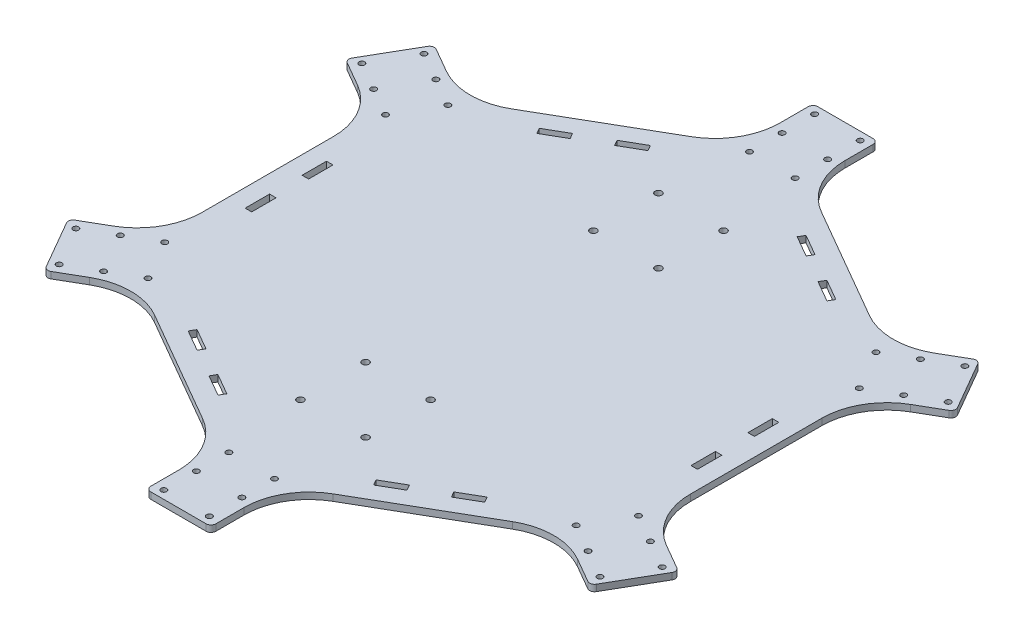
from build123d import *

# Parameters (mm, degrees)
SKETCH1_R             = 1.75
SKETCH1_W             = 4
SKETCH1_H             = 15
BOSS_EXTRUDE1_DEPTH   = 2
FILLET1_R             = 3
CIRPATTERN3_START     = -2
CIRPATTERN3_DEPTH     = 4
M5X0_8_TAPPED_HOLE1_D = 4.2


# Read off the part's stored shape, not the designer's step: CirPattern3
with BuildPart() as part:
    # Sketch1 → Boss-Extrude1 (new, symmetric)
    with BuildSketch(Plane(origin=(0, 0, 0), x_dir=(1, 0, 0), z_dir=(0, 1, 0))):
        with BuildLine():
            Line((109.999999797, 109.696551029), (40, 150.111069754))
            ThreePointArc((40, 150.111069754), (25.358983849, 164.752085906), (20, 184.752085906))
            Line((20, 184.752085906), (20, 205))
            Line((20, 205), (-20, 205))
            Line((-20, 205), (-20, 184.752085906))
            ThreePointArc((-20, 184.752085906), (-25.358983849, 164.752085906), (-40, 150.111069754))
            Line((-40, 150.111069754), (-109.999999797, 109.696551029))
            ThreePointArc((-109.999999797, 109.696551029), (-129.999999797, 104.33756718), (-149.999999797, 109.696551029))
            Line((-149.999999797, 109.696551029), (-167.535207776, 119.820508076))
            Line((-167.535207776, 119.820508076), (-187.535207776, 85.179491924))
            Line((-187.535207776, 85.179491924), (-169.999999797, 75.055534877))
            ThreePointArc((-169.999999797, 75.055534877), (-155.358983645, 60.414518726), (-149.999999797, 40.414518726))
            Line((-149.999999797, 40.414518726), (-149.999999797, -40.414518726))
            ThreePointArc((-149.999999797, -40.414518726), (-155.358983645, -60.414518726), (-169.999999797, -75.055534877))
            Line((-169.999999797, -75.055534877), (-187.535207776, -85.179491924))
            Line((-187.535207776, -85.179491924), (-167.535207776, -119.820508076))
            Line((-167.535207776, -119.820508076), (-149.999999797, -109.696551029))
            ThreePointArc((-149.999999797, -109.696551029), (-129.999999797, -104.33756718), (-109.999999797, -109.696551029))
            Line((-109.999999797, -109.696551029), (-40, -150.111069754))
            ThreePointArc((-40, -150.111069754), (-25.358983849, -164.752085906), (-20, -184.752085906))
            Line((-20, -184.752085906), (-20, -205))
            Line((-20, -205), (20, -205))
            Line((20, -205), (20, -184.752085906))
            ThreePointArc((20, -184.752085906), (25.358983849, -164.752085906), (40, -150.111069754))
            Line((40, -150.111069754), (109.999999797, -109.696551029))
            ThreePointArc((109.999999797, -109.696551029), (129.999999797, -104.33756718), (149.999999797, -109.696551029))
            Line((149.999999797, -109.696551029), (167.535207776, -119.820508076))
            Line((167.535207776, -119.820508076), (187.535207776, -85.179491924))
            Line((187.535207776, -85.179491924), (169.999999797, -75.055534877))
            ThreePointArc((169.999999797, -75.055534877), (155.358983645, -60.414518726), (149.999999797, -40.414518726))
            Line((149.999999797, -40.414518726), (149.999999797, 40.414518726))
            ThreePointArc((149.999999797, 40.414518726), (155.358983645, 60.414518726), (169.999999797, 75.055534877))
            Line((169.999999797, 75.055534877), (187.535207776, 85.179491924))
            Line((187.535207776, 85.179491924), (167.535207776, 119.820508076))
            Line((167.535207776, 119.820508076), (149.999999797, 109.696551029))
            ThreePointArc((149.999999797, 109.696551029), (129.999999797, 104.33756718), (109.999999797, 109.696551029))
        make_face()
        with Locations(Location((-14, 200, 0), (0, 0, 270))):
            Circle(SKETCH1_R, mode=Mode.SUBTRACT)
        with Locations(Location((-14, 180, 0), (0, 0, 270))):
            Circle(SKETCH1_R, mode=Mode.SUBTRACT)
        with Locations(Location((-14, 160, 0), (0, 0, 270))):
            Circle(SKETCH1_R, mode=Mode.SUBTRACT)
        with Locations(Location((14, 200, 0), (0, 0, 270))):
            Circle(SKETCH1_R, mode=Mode.SUBTRACT)
        with Locations(Location((14, 180, 0), (0, 0, 270))):
            Circle(SKETCH1_R, mode=Mode.SUBTRACT)
        with Locations(Location((14, 160, 0), (0, 0, 270))):
            Circle(SKETCH1_R, mode=Mode.SUBTRACT)
        with Locations(Location((145.564064606, 67.875644347, 0), (0, 0, 270))):
            Circle(SKETCH1_R, mode=Mode.SUBTRACT)
        with Locations(Location((131.564064606, 92.124355653, 0), (0, 0, 270))):
            Circle(SKETCH1_R, mode=Mode.SUBTRACT)
        with Locations(Location((162.884572681, 77.875644347, 0), (0, 0, 270))):
            Circle(SKETCH1_R, mode=Mode.SUBTRACT)
        with Locations(Location((180.205080757, 87.875644347, 0), (0, 0, 270))):
            Circle(SKETCH1_R, mode=Mode.SUBTRACT)
        with Locations(Location((166.205080757, 112.124355653, 0), (0, 0, 270))):
            Circle(SKETCH1_R, mode=Mode.SUBTRACT)
        with Locations(Location((148.884572681, 102.124355653, 0), (0, 0, 270))):
            Circle(SKETCH1_R, mode=Mode.SUBTRACT)
        with Locations(Location((131.564064606, -92.124355653, 0), (0, 0, 270))):
            Circle(SKETCH1_R, mode=Mode.SUBTRACT)
        with Locations(Location((145.564064606, -67.875644347, 0), (0, 0, 270))):
            Circle(SKETCH1_R, mode=Mode.SUBTRACT)
        with Locations(Location((148.884572681, -102.124355653, 0), (0, 0, 270))):
            Circle(SKETCH1_R, mode=Mode.SUBTRACT)
        with Locations(Location((166.205080757, -112.124355653, 0), (0, 0, 270))):
            Circle(SKETCH1_R, mode=Mode.SUBTRACT)
        with Locations(Location((180.205080757, -87.875644347, 0), (0, 0, 270))):
            Circle(SKETCH1_R, mode=Mode.SUBTRACT)
        with Locations(Location((162.884572681, -77.875644347, 0), (0, 0, 270))):
            Circle(SKETCH1_R, mode=Mode.SUBTRACT)
        with Locations(Location((-14, -160, 0), (0, 0, 270))):
            Circle(SKETCH1_R, mode=Mode.SUBTRACT)
        with Locations(Location((14, -160, 0), (0, 0, 270))):
            Circle(SKETCH1_R, mode=Mode.SUBTRACT)
        with Locations(Location((-14, -180, 0), (0, 0, 270))):
            Circle(SKETCH1_R, mode=Mode.SUBTRACT)
        with Locations(Location((-14, -200, 0), (0, 0, 270))):
            Circle(SKETCH1_R, mode=Mode.SUBTRACT)
        with Locations(Location((14, -200, 0), (0, 0, 270))):
            Circle(SKETCH1_R, mode=Mode.SUBTRACT)
        with Locations(Location((14, -180, 0), (0, 0, 270))):
            Circle(SKETCH1_R, mode=Mode.SUBTRACT)
        with Locations(Location((-145.564064606, -67.875644347, 0), (0, 0, 270))):
            Circle(SKETCH1_R, mode=Mode.SUBTRACT)
        with Locations(Location((-131.564064606, -92.124355653, 0), (0, 0, 270))):
            Circle(SKETCH1_R, mode=Mode.SUBTRACT)
        with Locations(Location((-162.884572681, -77.875644347, 0), (0, 0, 270))):
            Circle(SKETCH1_R, mode=Mode.SUBTRACT)
        with Locations(Location((-180.205080757, -87.875644347, 0), (0, 0, 270))):
            Circle(SKETCH1_R, mode=Mode.SUBTRACT)
        with Locations(Location((-166.205080757, -112.124355653, 0), (0, 0, 270))):
            Circle(SKETCH1_R, mode=Mode.SUBTRACT)
        with Locations(Location((-148.884572681, -102.124355653, 0), (0, 0, 270))):
            Circle(SKETCH1_R, mode=Mode.SUBTRACT)
        with Locations(Location((-131.564064606, 92.124355653, 0), (0, 0, 270))):
            Circle(SKETCH1_R, mode=Mode.SUBTRACT)
        with Locations(Location((-145.564064606, 67.875644347, 0), (0, 0, 270))):
            Circle(SKETCH1_R, mode=Mode.SUBTRACT)
        with Locations(Location((-148.884572681, 102.124355653, 0), (0, 0, 270))):
            Circle(SKETCH1_R, mode=Mode.SUBTRACT)
        with Locations(Location((-166.205080757, 112.124355653, 0), (0, 0, 270))):
            Circle(SKETCH1_R, mode=Mode.SUBTRACT)
        with Locations(Location((-180.205080757, 87.875644347, 0), (0, 0, 270))):
            Circle(SKETCH1_R, mode=Mode.SUBTRACT)
        with Locations(Location((-162.884572681, 77.875644347, 0), (0, 0, 270))):
            Circle(SKETCH1_R, mode=Mode.SUBTRACT)
        Polygon((89.150635095, -104.413429511), (76.160254038, -111.913429511), (78.160254038, -115.377531126), (91.150635095, -107.877531126), align=None, mode=Mode.SUBTRACT)
        with Locations((137, 17.5)):
            Rectangle(SKETCH1_W, SKETCH1_H, mode=Mode.SUBTRACT)
        with Locations((137, -17.5)):
            Rectangle(SKETCH1_W, SKETCH1_H, mode=Mode.SUBTRACT)
        Polygon((58.839745962, -121.913429511), (45.849364905, -129.413429511), (47.849364905, -132.877531126), (60.839745962, -125.377531126), align=None, mode=Mode.SUBTRACT)
        Polygon((-45.849364905, -129.413429511), (-58.839745962, -121.913429511), (-60.839745962, -125.377531126), (-47.849364905, -132.877531126), align=None, mode=Mode.SUBTRACT)
        Polygon((-76.160254038, -111.913429511), (-89.150635095, -104.413429511), (-91.150635095, -107.877531126), (-78.160254038, -115.377531126), align=None, mode=Mode.SUBTRACT)
        with Locations((-137, -17.5)):
            Rectangle(SKETCH1_W, SKETCH1_H, mode=Mode.SUBTRACT)
        with Locations((-137, 17.5)):
            Rectangle(SKETCH1_W, SKETCH1_H, mode=Mode.SUBTRACT)
        Polygon((-89.150635095, 104.413429511), (-76.160254038, 111.913429511), (-78.160254038, 115.377531126), (-91.150635095, 107.877531126), align=None, mode=Mode.SUBTRACT)
        Polygon((-58.839745962, 121.913429511), (-45.849364905, 129.413429511), (-47.849364905, 132.877531126), (-60.839745962, 125.377531126), align=None, mode=Mode.SUBTRACT)
        Polygon((45.849364905, 129.413429511), (58.839745962, 121.913429511), (60.839745962, 125.377531126), (47.849364905, 132.877531126), align=None, mode=Mode.SUBTRACT)
        Polygon((76.160254038, 111.913429511), (89.150635095, 104.413429511), (91.150635095, 107.877531126), (78.160254038, 115.377531126), align=None, mode=Mode.SUBTRACT)
    extrude(amount=BOSS_EXTRUDE1_DEPTH, both=True)

    # Fillet1
    fillet1_edges = [part.edges().sort_by_distance(p)[0] for p in [
        (-20, 0, -205),
        (20, 0, -205),
    ]]
    fillet(fillet1_edges, radius=FILLET1_R)

    # CirPattern3 outline → CirPattern3 (cut)
    with BuildSketch(Plane(origin=(0, 0, 0), x_dir=(1, 0, 0), z_dir=(0, 1, 0)).offset(CIRPATTERN3_START)):
        with BuildLine():
            Line((187.535207776, 85.179491924), (186.035207776, 87.777568136))
            ThreePointArc((186.035207776, 87.777568136), (186.334909043, 85.501111), (184.937131564, 83.679491924))
            Line((184.937131564, 83.679491924), (187.535207776, 85.179491924))
        make_face()
        with BuildLine():
            ThreePointArc((164.937131564, 118.320508076), (167.2135887, 118.620209343), (169.035207776, 117.222431864))
            Line((169.035207776, 117.222431864), (167.535207776, 119.820508076))
            Line((167.535207776, 119.820508076), (164.937131564, 118.320508076))
        make_face()
        with BuildLine():
            Line((167.535207776, -119.820508076), (169.035207776, -117.222431864))
            ThreePointArc((169.035207776, -117.222431864), (167.2135887, -118.620209343), (164.937131564, -118.320508076))
            Line((164.937131564, -118.320508076), (167.535207776, -119.820508076))
        make_face()
        with BuildLine():
            ThreePointArc((184.937131564, -83.679491924), (186.334909043, -85.501111), (186.035207776, -87.777568136))
            Line((186.035207776, -87.777568136), (187.535207776, -85.179491924))
            Line((187.535207776, -85.179491924), (184.937131564, -83.679491924))
        make_face()
        with BuildLine():
            Line((-20, -205), (-17, -205))
            ThreePointArc((-17, -205), (-19.121320344, -204.121320344), (-20, -202))
            Line((-20, -202), (-20, -205))
        make_face()
        with BuildLine():
            ThreePointArc((20, -202), (19.121320344, -204.121320344), (17, -205))
            Line((17, -205), (20, -205))
            Line((20, -205), (20, -202))
        make_face()
        with BuildLine():
            Line((-187.535207776, -85.179491924), (-186.035207776, -87.777568136))
            ThreePointArc((-186.035207776, -87.777568136), (-186.334909043, -85.501111), (-184.937131564, -83.679491924))
            Line((-184.937131564, -83.679491924), (-187.535207776, -85.179491924))
        make_face()
        with BuildLine():
            ThreePointArc((-164.937131564, -118.320508076), (-167.2135887, -118.620209343), (-169.035207776, -117.222431864))
            Line((-169.035207776, -117.222431864), (-167.535207776, -119.820508076))
            Line((-167.535207776, -119.820508076), (-164.937131564, -118.320508076))
        make_face()
        with BuildLine():
            Line((-167.535207776, 119.820508076), (-169.035207776, 117.222431864))
            ThreePointArc((-169.035207776, 117.222431864), (-167.2135887, 118.620209343), (-164.937131564, 118.320508076))
            Line((-164.937131564, 118.320508076), (-167.535207776, 119.820508076))
        make_face()
        with BuildLine():
            ThreePointArc((-184.937131564, 83.679491924), (-186.334909043, 85.501111), (-186.035207776, 87.777568136))
            Line((-186.035207776, 87.777568136), (-187.535207776, 85.179491924))
            Line((-187.535207776, 85.179491924), (-184.937131564, 83.679491924))
        make_face()
    extrude(amount=CIRPATTERN3_DEPTH, mode=Mode.SUBTRACT)

    # M5x0.8 Tapped Hole1 (through all)
    with Locations(Plane(origin=(0, 2, 0), x_dir=(1, 0, 0), z_dir=(0, 1, 0))):
        with Locations((-20, 110), (20, 110), (20, 70), (-20, 70)):
            m5x0_8_tapped_hole1 = Hole(M5X0_8_TAPPED_HOLE1_D / 2)

    # Mirror1: M5x0.8 Tapped Hole1 across plane
    add(m5x0_8_tapped_hole1.mirror(Plane.XY), mode=Mode.SUBTRACT)


solid = part.part
